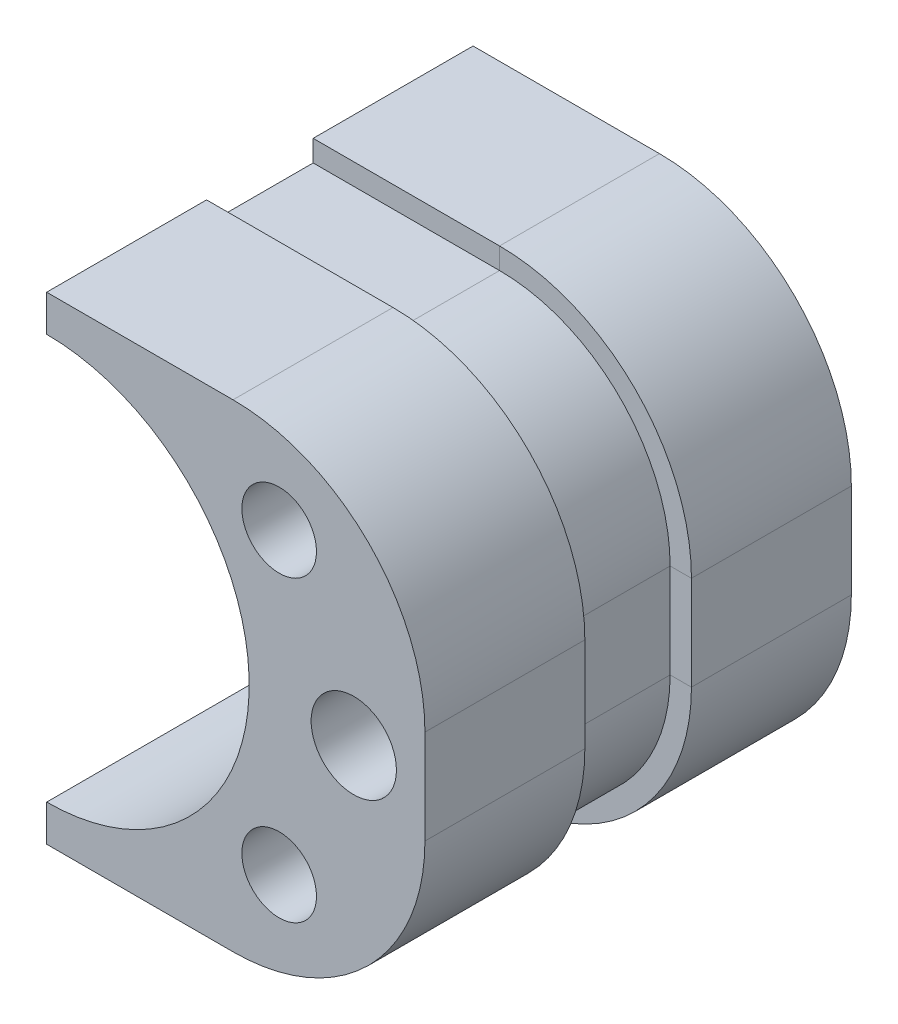
from build123d import *

# Parameters (mm, degrees)
ESBO_O1_R                = 1.393053459
RESSALTO_EXTRUS_O1_DEPTH = 40
ESBO_O8_W                = 10
ESBO_O8_H                = 2
ESBO_O10_R               = 3.5
CORTE_EXTRUS_O1_DEPTH    = 10


with BuildPart() as part:
    # Esboço1 → Ressalto-extrusão1 (new body)
    # profile 1 of 2: a face of its own
    with BuildSketch(Plane.XY):
        with BuildLine():
            ThreePointArc((0.112562331, 19), (13.547591173, 13.435028843), (19.112562331, 0))
            Line((19.112562331, 0), (24.9231968, 0))
            ThreePointArc((24.9231968, 0), (28.9231968, 4), (32.9231968, 0))
            Line((32.9231968, 0), (35.598208573, 0))
            Line((35.598208573, 0), (35.598208573, 4.423877672))
            ThreePointArc((35.598208573, 4.423877672), (30.326130634, 17.151799733), (17.598208573, 22.423877672))
            Line((17.598208573, 22.423877672), (0.112562331, 22.423877672))
            Line((0.112562331, 22.423877672), (0.112562331, 19))
        make_face()
        with Locations((21.9231968, 14)):
            Circle(ESBO_O1_R, mode=Mode.SUBTRACT)
    # profile 2 of 2: a face of its own
    with BuildSketch(Plane.XY):
        with BuildLine():
            Line((24.9231968, 0), (19.112562331, 0))
            ThreePointArc((19.112562331, 0), (13.547591173, -13.435028843), (0.112562331, -19))
            Line((0.112562331, -19), (0.112562331, -22.423877672))
            Line((0.112562331, -22.423877672), (17.598208573, -22.423877672))
            ThreePointArc((17.598208573, -22.423877672), (30.326130634, -17.151799733), (35.598208573, -4.423877672))
            Line((35.598208573, -4.423877672), (35.598208573, 0))
            Line((35.598208573, 0), (32.9231968, 0))
            ThreePointArc((32.9231968, 0), (28.9231968, -4), (24.9231968, 0))
        make_face()
        with Locations((21.9231968, -14)):
            Circle(ESBO_O1_R, mode=Mode.SUBTRACT)
    extrude(amount=RESSALTO_EXTRUS_O1_DEPTH)

    # Varredura de corte1: sweep along a path in Esboço9
    with BuildLine(Plane.XY.offset(40)) as varredura_de_corte1_path:
        Line((0.112562331, -22.423877672), (17.598208573, -22.423877672))
        ThreePointArc((17.598208573, -22.423877672), (30.326130634, -17.151799733), (35.598208573, -4.423877672))
        Line((35.598208573, -4.423877672), (35.598208573, 4.423877672))
        ThreePointArc((35.598208573, 4.423877672), (30.326130634, 17.151799733), (17.598208573, 22.423877672))
        Line((17.598208573, 22.423877672), (0.112562331, 22.423877672))
    # Esboço8 → Varredura de corte1 (sweep, cut)
    with BuildSketch(Plane.ZY.offset(-0.112562331)):
        with Locations((20, 21.423877672)):
            Rectangle(ESBO_O8_W, ESBO_O8_H)
    sweep(path=varredura_de_corte1_path.line, mode=Mode.SUBTRACT)

    # Esboço10 → Corte-extrusão1 (cut)
    with BuildSketch(Plane.XY.offset(40)):
        with Locations((21.9231968, 14)):
            Circle(ESBO_O10_R)
        with Locations((21.9231968, -14)):
            Circle(ESBO_O10_R)
    extrude(amount=-CORTE_EXTRUS_O1_DEPTH, mode=Mode.SUBTRACT)


solid = part.part
